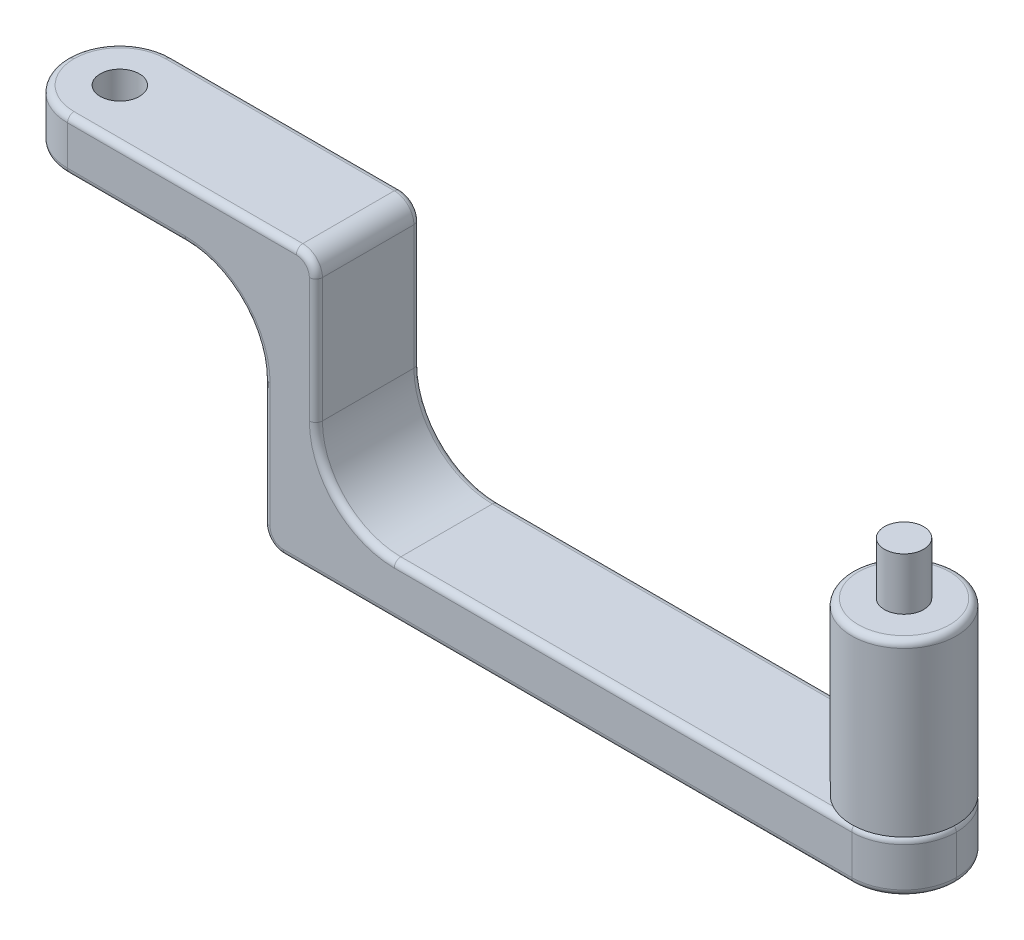
from build123d import *

# Parameters (mm, degrees)
BOSS_EXTRUDE1_DEPTH = 40
SKETCH2_R           = 40
BOSS_EXTRUDE2_DEPTH = 170
SKETCH3_R           = 40
SKETCH3_R_2         = 15
CUT_EXTRUDE1_DEPTH  = 40
SKETCH4_R           = 15
CUT_EXTRUDE2_DEPTH  = 675.759216313
FILLET1_R           = 40
FILLET2_R           = 40
FILLET3_R           = 5
FILLET4_R           = 5


with BuildPart() as part:
    # Sketch1 → Boss-Extrude1 (new, symmetric)
    with BuildSketch(Plane.XY):
        with BuildLine():
            Line((0, -20), (-40, -20))
            Line((-40, -20), (-40, 20))
            Line((-40, 20), (0, 20))
            Line((0, 20), (175, 20))
            ThreePointArc((175, 20), (185.606601718, 15.606601718), (190, 5))
            Line((190, 5), (190, -90))
            ThreePointArc((190, -90), (207.573593129, -132.426406871), (250, -150))
            Line((250, -150), (640, -150))
            Line((640, -150), (640, -190))
            Line((640, -190), (165, -190))
            ThreePointArc((165, -190), (154.393398282, -185.606601718), (150, -175))
            Line((150, -175), (150, -80))
            ThreePointArc((150, -80), (132.426406871, -37.573593129), (90, -20))
            Line((90, -20), (0, -20))
        make_face()
    extrude(amount=BOSS_EXTRUDE1_DEPTH, both=True)

    # Sketch4 → Cut-Extrude2 (cut, through all)
    with BuildSketch(Plane(origin=(0, 20, 0), x_dir=(1, 0, 0), z_dir=(0, 1, 0))):
        with Locations(Location((0, 0, 0), (0, 0, 180))):
            Circle(SKETCH4_R)
    extrude(amount=-CUT_EXTRUDE2_DEPTH, mode=Mode.SUBTRACT)

    # Fillet1
    fillet1_edges = [part.edges().sort_by_distance(p)[0] for p in [
        (640, -170, 40),
        (640, -170, -40),
    ]]
    fillet(fillet1_edges, radius=FILLET1_R - 0.0001)  # a hair under: the kernel refuses the full size

    # Fillet2
    fillet2_edges = [part.edges().sort_by_distance(p)[0] for p in [
        (-40, 0, 40),
        (-40, 0, -40),
    ]]
    fillet(fillet2_edges, radius=FILLET2_R - 0.0001)  # a hair under: the kernel refuses the full size

    # Fillet4
    fillet4_edges = [part.edges().sort_by_distance(p)[0] for p in [
        (150, -127.5, 40),
        (87.49995, 20, -40),
        (185.606601718, 15.606601718, -40),
        (190, -42.5, -40),
        (207.573593129, -132.426406871, -40),
        (154.393398282, -185.606601718, 40),
        (382.50005, -190, -40),
        (154.393398282, -185.606601718, -40),
        (150, -127.5, -40),
        (132.426406871, -37.573593129, -40),
        (382.50005, -190, 40),
        (207.573593129, -132.426406871, 40),
        (190, -42.5, 40),
        (185.606601718, 15.606601718, 40),
        (87.49995, 20, 40),
        (425.00005, -150, 40),
        (425.00005, -150, -40),
        (628.284300537, -150, -28.284300537),
        (628.284300537, -150, 28.284300537),
        (628.284300537, -190, -28.284300537),
        (628.284300537, -190, 28.284300537),
        (44.99995, -20, 40),
        (44.99995, -20, -40),
        (-28.284300537, -20, -28.284300537),
        (-28.284300537, -20, 28.284300537),
        (-28.284300537, 20, -28.284300537),
        (-28.284300537, 20, 28.284300537),
        (132.426406871, -37.573593129, 40),
    ]]
    fillet(fillet4_edges, radius=FILLET4_R)


with BuildPart() as body_2:
    # Sketch2 → Boss-Extrude2 (new body)
    with BuildSketch(Plane(origin=(0, -150, 0), x_dir=(1, 0, 0), z_dir=(0, 1, 0))):
        with Locations((600, 0)):
            Circle(SKETCH2_R)
    extrude(amount=BOSS_EXTRUDE2_DEPTH)

    # Sketch3 → Cut-Extrude1 (cut)
    with BuildSketch(Plane(origin=(0, 20, 0), x_dir=(1, 0, 0), z_dir=(0, 1, 0))):
        with Locations(Location((600, 0, 0), (0, 0, 180))):
            Circle(SKETCH3_R)
        with Locations(Location((600, 0, 0), (0, 0, 180))):
            Circle(SKETCH3_R_2, mode=Mode.SUBTRACT)
    extrude(amount=-CUT_EXTRUDE1_DEPTH, mode=Mode.SUBTRACT)

    # Fillet3
    fillet3_edges = [body_2.edges().sort_by_distance(p)[0] for p in [
        (560, -20, 0),
    ]]
    fillet(fillet3_edges, radius=FILLET3_R)


solid = Compound([part.part, body_2.part])
